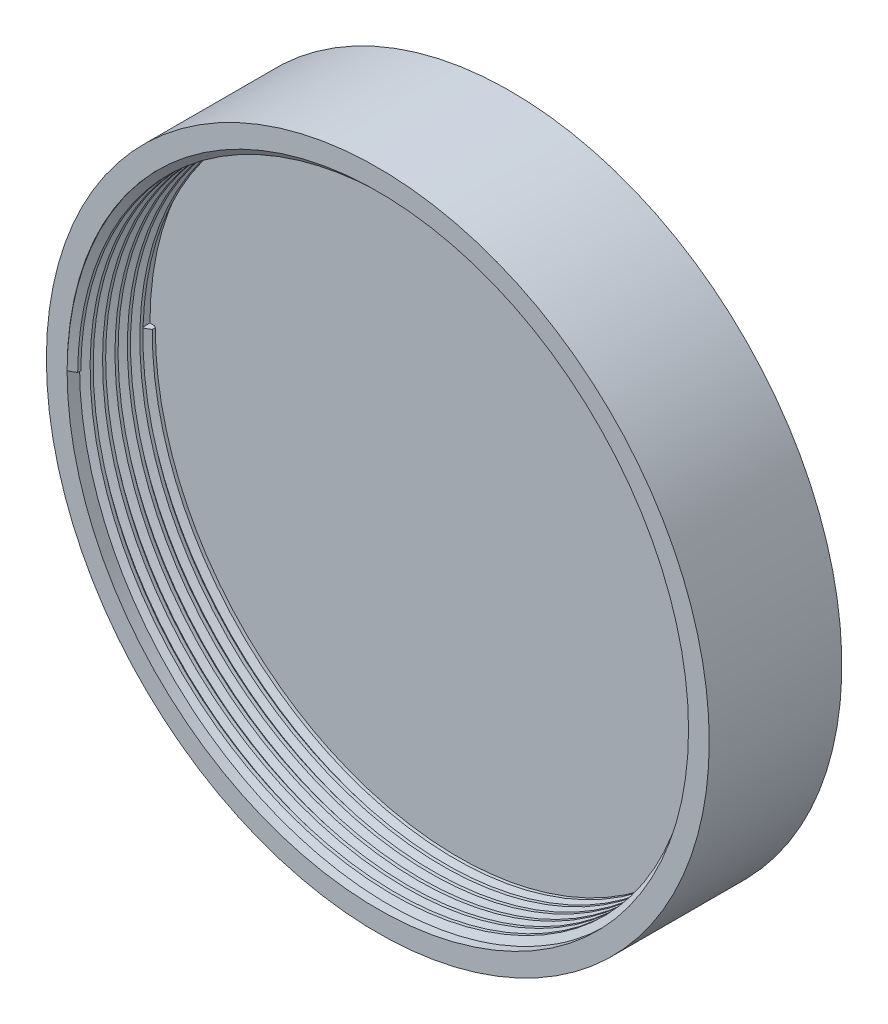
from build123d import *

# Parameters (mm, degrees)
SZKIC1_R                    = 80
DODANIE_WYCI_GNI_CIE1_DEPTH = 30
SZKIC2_R                    = 75
WYTNIJ_WYCI_GNI_CIE2_DEPTH  = 20
DODANIE_WYCI_GNI_CIE2_START = 22
SZKIC20_R                   = 80
DODANIE_WYCI_GNI_CIE2_DEPTH = 22
SZKIC22_R                   = 80
SZKIC22_R_2                 = 35
WYTNIJ_WYCI_GNI_CIE3_DEPTH  = 20
GWINT1_PITCH                = 3


with BuildPart() as part:
    # Szkic1 → Dodanie-wyciągnięcie1 (new body)
    with BuildSketch(Plane.XY):
        Circle(SZKIC1_R)
    extrude(amount=DODANIE_WYCI_GNI_CIE1_DEPTH)

    # Szkic2 → Wytnij-wyciągnięcie2 (cut)
    with BuildSketch(Plane.XY.offset(30)):
        Circle(SZKIC2_R)
    extrude(amount=-WYTNIJ_WYCI_GNI_CIE2_DEPTH, mode=Mode.SUBTRACT)

    # Szkic20 → Dodanie-wyciągnięcie2 (add)
    with BuildSketch(Plane(origin=(0, 0, 0), x_dir=(-1, 0, 0), z_dir=(0, 0, -1)).offset(DODANIE_WYCI_GNI_CIE2_START)):
        Circle(SZKIC20_R)
    extrude(amount=-DODANIE_WYCI_GNI_CIE2_DEPTH)

    # Szkic21 → Wycięcie-obrót1 (revolve, cut)
    with BuildSketch(Plane(origin=(0, 0, 0), x_dir=(1, 0, 0), z_dir=(0, 1, 0))):
        Polygon((0, 22), (0, -7.46), (-5, -2.46), (-5, 10.34), (-10.600297611, 20.04), (-13.995117194, 22), align=None)
    revolve(axis=Axis((0, 0, 0), (0, 0, 1)), mode=Mode.SUBTRACT)

    # Szkic22 → Wytnij-wyciągnięcie3 (cut)
    with BuildSketch(Plane(origin=(0, 0, -22), x_dir=(-1, 0, 0), z_dir=(0, 0, -1))):
        Circle(SZKIC22_R)
        Circle(SZKIC22_R_2, mode=Mode.SUBTRACT)
    extrude(amount=-WYTNIJ_WYCI_GNI_CIE3_DEPTH, mode=Mode.SUBTRACT)

    # Gwint1: the profile of Thread Profile2 profile screwed along a right-hand helix of 6 turns, 10 arcs to a turn; built about Z, then put on its axis
    gwint1_z = Axis((0, 0, 0), (0, 0, 1))
    gwint1_corners = [(75.0003, 0, -0.000173205), (75.0003, 0, 2.625173197), (73.376202375, 0, 1.687499996), (73.376202375, 0, 0.937499996)]
    with BuildLine(mode=Mode.PRIVATE) as gwint1_profile:
        Line(gwint1_corners[0], gwint1_corners[1])
        Line(gwint1_corners[1], gwint1_corners[2])
        Line(gwint1_corners[2], gwint1_corners[3])
        Line(gwint1_corners[3], gwint1_corners[0])
    gwint1_cap = Face(gwint1_profile.wire())
    gwint1_turn_angles = [0, 18, 36, 54, 72, 90, 108, 126, 144, 162, 180, 198, 216, 234, 252, 270, 288, 306, 324, 342, 360]
    gwint1_turn_weights = [1, 0.9510565162951535, 1, 0.9510565162951535, 1, 0.9510565162951535, 1, 0.9510565162951535, 1, 0.9510565162951535, 1, 0.9510565162951535, 1, 0.9510565162951535, 1, 0.9510565162951535, 1, 0.9510565162951535, 1, 0.9510565162951535, 1]
    gwint1_turn_rails = [Edge.make_bspline([Vector(p[0], p[1], 0).rotate(gwint1_z, gwint1_turn_angles[k]) / gwint1_turn_weights[k] + Vector(0, 0, p[2] + GWINT1_PITCH * gwint1_turn_angles[k] / 360) for k in range(21)], [0, 0, 0, 1, 1, 2, 2, 3, 3, 4, 4, 5, 5, 6, 6, 7, 7, 8, 8, 9, 9, 10, 10, 10], 2, gwint1_turn_weights) for p in gwint1_corners]
    gwint1_turn_sides = [Face.make_surface_from_curves(gwint1_turn_rails[p[0]], gwint1_turn_rails[p[1]]) for p in [(0, 1), (1, 2), (2, 3), (3, 0)]]
    gwint1 = Plane(origin=(0, 0, 30), x_dir=(-1, 0, 0), z_dir=(0, 0, -1)) * Solid(Shell([*[p.moved(Location((0, 0, GWINT1_PITCH * i))) for i in range(6) for p in gwint1_turn_sides], gwint1_cap, gwint1_cap.rotate(gwint1_z, 2160).moved(Location((0, 0, GWINT1_PITCH * 2160 / 360)))]))
    add(gwint1)


solid = part.part
